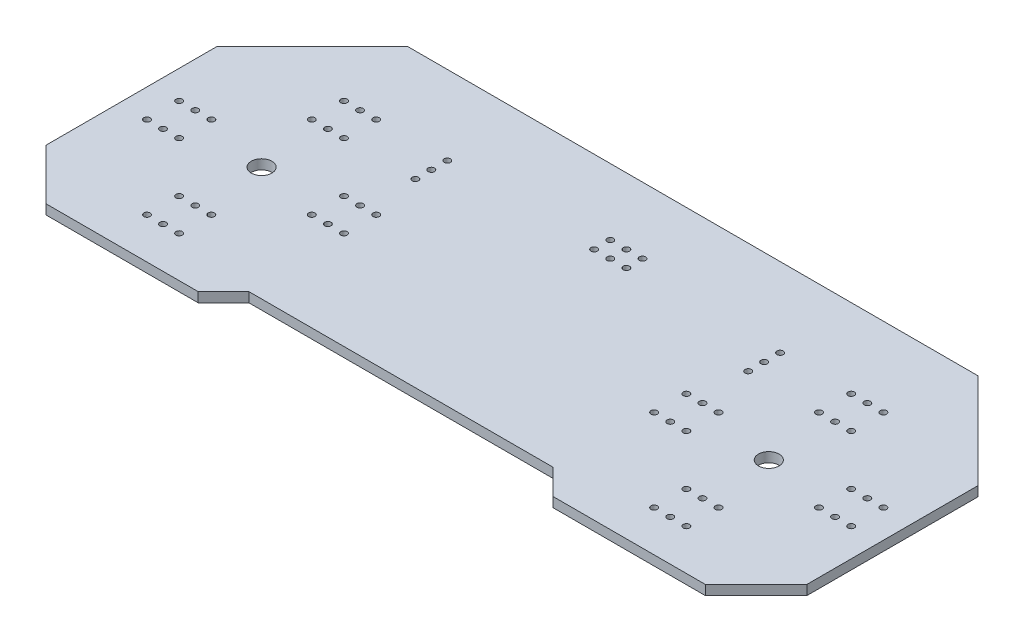
from build123d import *

# Parameters (mm, degrees)
SKETCH1_W           = 120
SKETCH1_H           = 50
BOSS_EXTRUDE1_DEPTH = 1.53
SKETCH2_R           = 0.5
SKETCH2_R_2         = 1.625
CUT_EXTRUDE1_DEPTH  = 67.229456437
SKETCH5_R           = 0.5
CUT_EXTRUDE2_DEPTH  = 67.229456437
SKETCH6_W           = 141.050966046
SKETCH6_H           = 69.53153639
CUT_EXTRUDE4_DEPTH  = 67.229456437
SKETCH7_R           = 0.5
CUT_EXTRUDE5_DEPTH  = 67.229456437


with BuildPart() as part:
    # Sketch1 → Boss-Extrude1 (new body)
    with BuildSketch(Plane(origin=(0, 0, 0), x_dir=(1, 0, 0), z_dir=(0, 1, 0))):
        with Locations((0, 3)):
            Rectangle(SKETCH1_W, SKETCH1_H)
    extrude(amount=BOSS_EXTRUDE1_DEPTH)

    # Sketch2 → Cut-Extrude1 (cut, through all)
    with BuildSketch(Plane(origin=(0, 1.53, 0), x_dir=(1, 0, 0), z_dir=(0, 1, 0))):
        with Locations((-55.54, 2.54)):
            Circle(SKETCH2_R)
        with Locations((-53, 2.54)):
            Circle(SKETCH2_R)
        with Locations((-50.46, 2.54)):
            Circle(SKETCH2_R)
        with Locations((-55.54, -2.54)):
            Circle(SKETCH2_R)
        with Locations((-53, -2.54)):
            Circle(SKETCH2_R)
        with Locations((-50.46, -2.54)):
            Circle(SKETCH2_R)
        with Locations((-29.54, 2.54)):
            Circle(SKETCH2_R)
        with Locations((-27, 2.54)):
            Circle(SKETCH2_R)
        with Locations((-24.46, 2.54)):
            Circle(SKETCH2_R)
        with Locations((-29.54, -2.54)):
            Circle(SKETCH2_R)
        with Locations((-27, -2.54)):
            Circle(SKETCH2_R)
        with Locations((-24.46, -2.54)):
            Circle(SKETCH2_R)
        with Locations((-42.54, 15.54)):
            Circle(SKETCH2_R)
        with Locations((-40, 15.54)):
            Circle(SKETCH2_R)
        with Locations((-37.46, 15.54)):
            Circle(SKETCH2_R)
        with Locations((-42.54, 10.46)):
            Circle(SKETCH2_R)
        with Locations((-40, 10.46)):
            Circle(SKETCH2_R)
        with Locations((-37.46, 10.46)):
            Circle(SKETCH2_R)
        with Locations((-42.54, -10.46)):
            Circle(SKETCH2_R)
        with Locations((-40, -10.46)):
            Circle(SKETCH2_R)
        with Locations((-37.46, -10.46)):
            Circle(SKETCH2_R)
        with Locations((-42.54, -15.54)):
            Circle(SKETCH2_R)
        with Locations((-40, -15.54)):
            Circle(SKETCH2_R)
        with Locations((-37.46, -15.54)):
            Circle(SKETCH2_R)
        with Locations((-40, 0)):
            Circle(SKETCH2_R_2)
    cut_extrude1 = extrude(amount=-CUT_EXTRUDE1_DEPTH, mode=Mode.SUBTRACT)

    # Mirror1: Cut-Extrude1 across plane
    add(cut_extrude1.mirror(Plane(origin=(0, 0, 0), x_dir=(0, 0, 1), z_dir=(1, 0, 0))), mode=Mode.SUBTRACT)

    # Sketch5 → Cut-Extrude2 (cut, through all)
    with BuildSketch(Plane(origin=(0, 1.53, 0), x_dir=(1, 0, 0), z_dir=(0, 1, 0))):
        with Locations((-2.54, 17.54)):
            Circle(SKETCH5_R)
        with Locations((0, 17.54)):
            Circle(SKETCH5_R)
        with Locations((2.54, 17.54)):
            Circle(SKETCH5_R)
        with Locations((-2.54, 15)):
            Circle(SKETCH5_R)
        with Locations((0, 15)):
            Circle(SKETCH5_R)
        with Locations((2.54, 15)):
            Circle(SKETCH5_R)
    extrude(amount=-CUT_EXTRUDE2_DEPTH, mode=Mode.SUBTRACT)

    # Sketch6 → Cut-Extrude4 (cut, through all)
    with BuildSketch(Plane(origin=(0, 1.53, 0), x_dir=(1, 0, 0), z_dir=(0, 1, 0))):
        Rectangle(SKETCH6_W, SKETCH6_H)
        Polygon((-45, 28), (-60, 13), (-60, -14), (-52, -22), (-28, -22), (-24, -18), (24, -18), (28, -22), (52, -22), (60, -14), (60, 13), (45, 28), align=None, mode=Mode.SUBTRACT)
    extrude(amount=-CUT_EXTRUDE4_DEPTH, mode=Mode.SUBTRACT)

    # Sketch7 → Cut-Extrude5 (cut, through all)
    with BuildSketch(Plane(origin=(0, 1.53, 0), x_dir=(1, 0, 0), z_dir=(0, 1, 0))):
        with Locations((-26.25, 15.54)):
            Circle(SKETCH7_R)
        with Locations((-26.25, 13.02)):
            Circle(SKETCH7_R)
        with Locations((-26.25, 10.5)):
            Circle(SKETCH7_R)
        with Locations((26.25, 10.5)):
            Circle(SKETCH7_R)
        with Locations((26.25, 13.02)):
            Circle(SKETCH7_R)
        with Locations((26.25, 15.54)):
            Circle(SKETCH7_R)
    extrude(amount=-CUT_EXTRUDE5_DEPTH, mode=Mode.SUBTRACT)


solid = part.part
